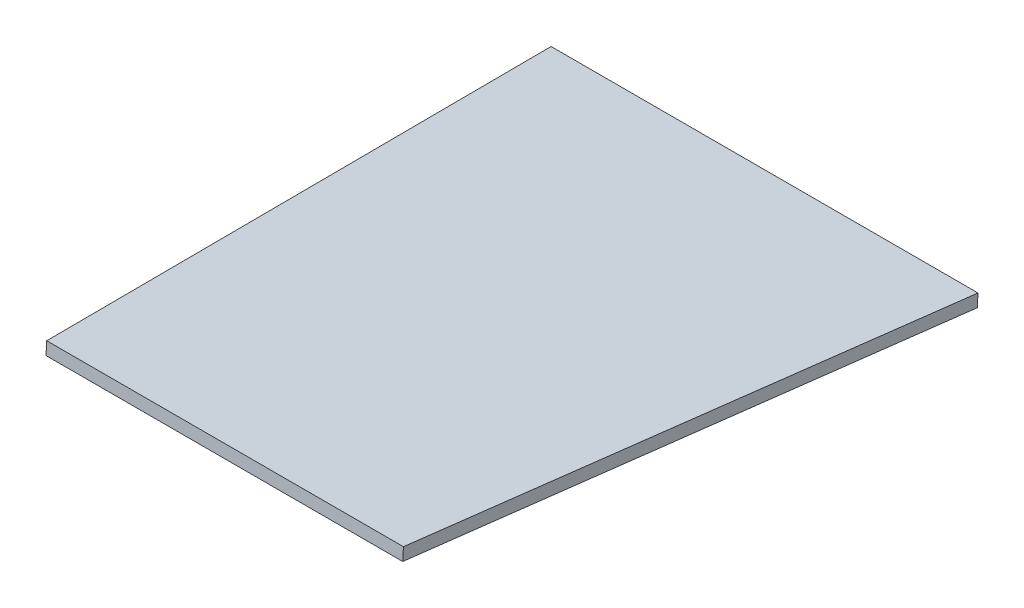
from build123d import *

# Parameters (mm, degrees)
BOSS_EXTRUDE1_DEPTH = 12.7


with BuildPart() as part:
    # PedalBox Floor → Boss-Extrude1 (new body)
    with BuildSketch(Plane(origin=(0, -11.912117549, 0.716369544), x_dir=(-1, 0, 0), z_dir=(0, -0.9981966075420028, 0.06002943187834598))):
        Polygon((349.508396528, -1328.852468005), (385.231552856, -1878.721415166), (748.168376379, -1878.721415166), (783.891532707, -1328.852468005), align=None)
    extrude(amount=BOSS_EXTRUDE1_DEPTH)


solid = part.part
